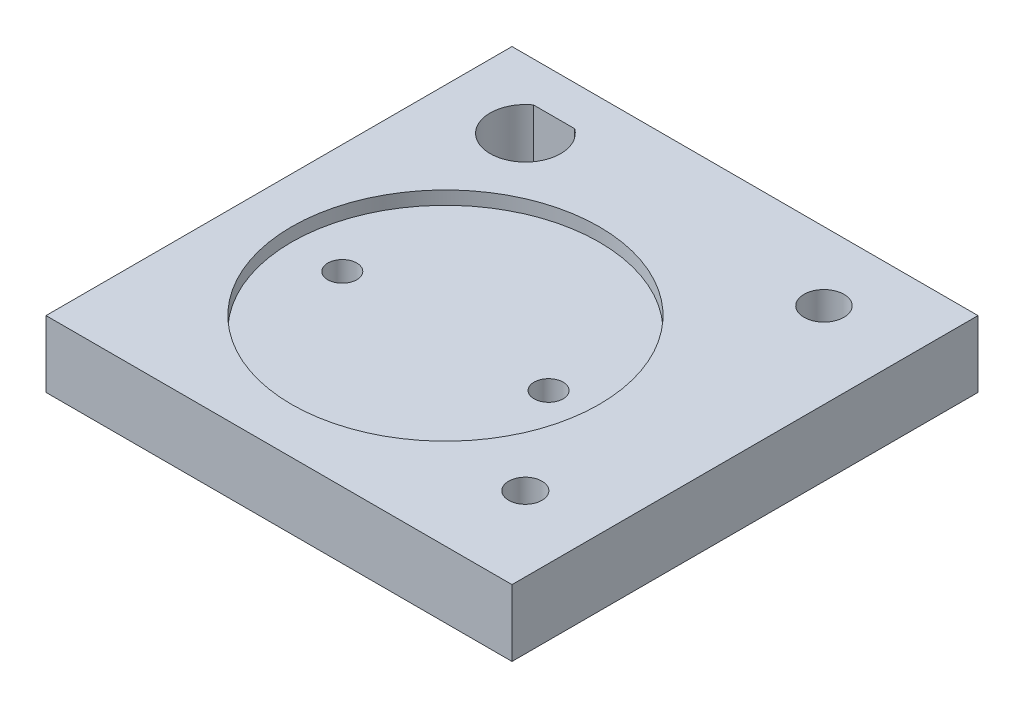
from build123d import *

# Parameters (mm, degrees)
SKETCH2_W           = 35
SKETCH2_H           = 35
BOSS_EXTRUDE1_DEPTH = 5
SKETCH3_R           = 11.557
CUT_EXTRUDE1_DEPTH  = 1
SKETCH4_R           = 1.09
CUT_EXTRUDE2_DEPTH  = 50.658836072
SKETCH5_R           = 1.25
SKETCH5_R_2         = 1.5
CUT_EXTRUDE3_DEPTH  = 50.749371855


with BuildPart() as part:
    # Sketch2 → Boss-Extrude1 (new body)
    with BuildSketch(Plane(origin=(0, 0, 0), x_dir=(1, 0, 0), z_dir=(0, 1, 0))):
        with Locations((17.5, 17.5)):
            Rectangle(SKETCH2_W, SKETCH2_H)
    extrude(amount=BOSS_EXTRUDE1_DEPTH)

    # Sketch3 → Cut-Extrude1 (cut)
    with BuildSketch(Plane(origin=(0, 5, 0), x_dir=(1, 0, 0), z_dir=(0, 1, 0))):
        with Locations((15, 15)):
            Circle(SKETCH3_R)
    extrude(amount=-CUT_EXTRUDE1_DEPTH, mode=Mode.SUBTRACT)

    # Sketch4 → Cut-Extrude2 (cut, through all)
    with BuildSketch(Plane(origin=(0, 4, 0), x_dir=(1, 0, 0), z_dir=(0, 1, 0))):
        with Locations((7.253, 15)):
            Circle(SKETCH4_R)
        with Locations((22.747, 15)):
            Circle(SKETCH4_R)
    extrude(amount=-CUT_EXTRUDE2_DEPTH, mode=Mode.SUBTRACT)

    # Sketch5 → Cut-Extrude3 (cut, through all)
    with BuildSketch(Plane(origin=(0, 5, 0), x_dir=(1, 0, 0), z_dir=(0, 1, 0))):
        with Locations((29.394935124, 6.606107028)):
            Circle(SKETCH5_R)
        with Locations((28.580448658, 29.849617578)):
            Circle(SKETCH5_R_2)
        with BuildLine():
            Line((4.598935127, 32.009339935), (7.697321804, 32.009339935))
            ThreePointArc((7.697321804, 32.009339935), (6.148128466, 27.209339935), (4.598935127, 32.009339935))
        make_face()
    extrude(amount=-CUT_EXTRUDE3_DEPTH, mode=Mode.SUBTRACT)


solid = part.part
